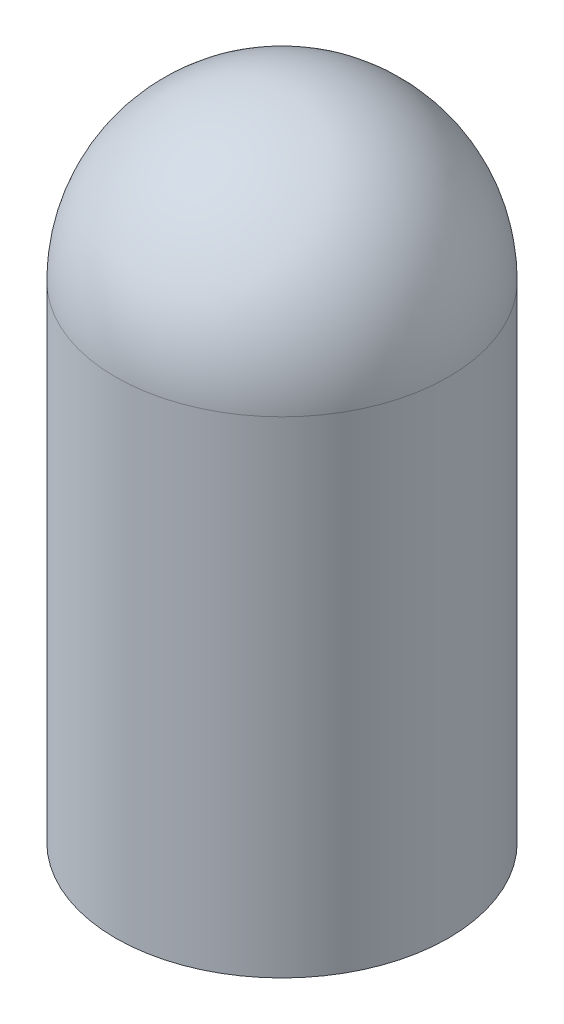
from build123d import *


with BuildPart() as part:
    # Sketch1 → Revolve1 (revolve)
    with BuildSketch(Plane.XY):
        with BuildLine():
            Line((25.5, 74.5), (25.5, 0))
            Line((25.5, 0), (0, 0))
            Line((0, 0), (0, 100))
            ThreePointArc((0, 100), (18.03122292, 92.53122292), (25.5, 74.5))
        make_face()
    revolve(axis=Axis((0, 130.936397857, 0), (0, -1, 0)))


solid = part.part
